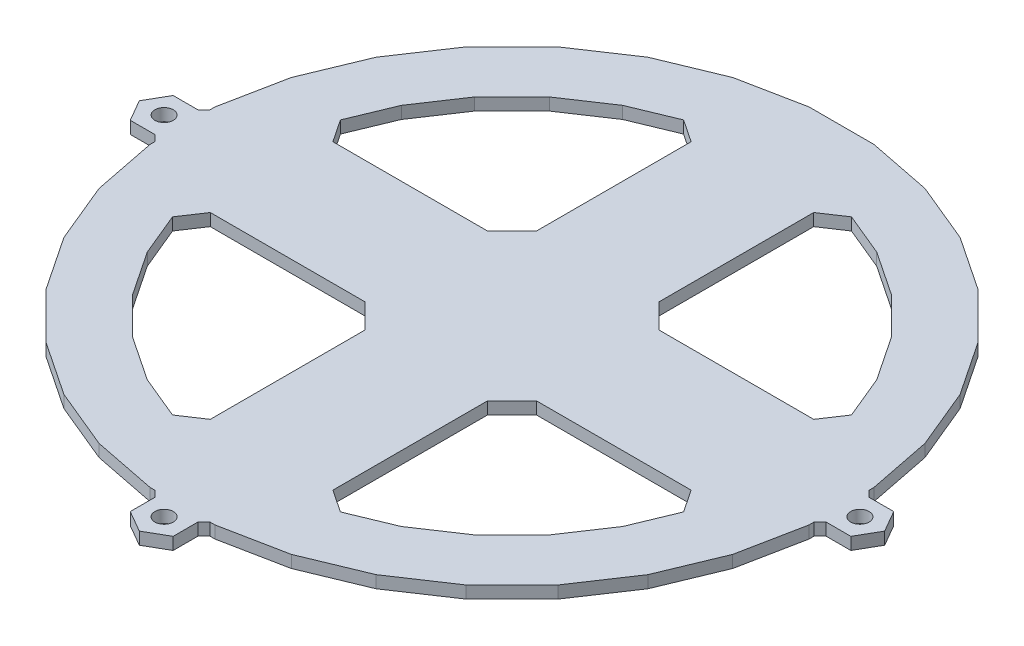
from build123d import *

# Parameters (mm, degrees)
BOSS_EXTRUDE1_DEPTH = 2
SKETCH3_W           = 20
SKETCH3_H           = 87.5
BOSS_EXTRUDE4_DEPTH = 2
CIRPATTERN1_COUNT   = 2
CIRPATTERN1_ANGLE   = 90
CHAMFER1_DEPTH      = 2
SKETCH5_R           = 1.5
BOSS_EXTRUDE6_DEPTH = 2
CHAMFER3_SIZE       = 1


with BuildPart() as part:
    # Sketch1 → Boss-Extrude1 (new body)
    with BuildSketch(Plane(origin=(0, 0, 0), x_dir=(1, 0, 0), z_dir=(0, 1, 0))):
        Polygon((53.75, 5.29391293), (51.684417643, 15.678296686), (47.632632102, 25.460172293), (41.750351221, 34.263627757), (34.263627757, 41.750351221), (25.460172293, 47.632632102), (15.678296686, 51.684417643), (5.29391293, 53.75), (-5.29391293, 53.75), (-15.678296686, 51.684417643), (-25.460172293, 47.632632102), (-34.263627757, 41.750351221), (-41.750351221, 34.263627757), (-47.632632102, 25.460172293), (-51.684417643, 15.678296686), (-53.75, 5.29391293), (-53.75, -5.29391293), (-51.684417643, -15.678296686), (-47.632632102, -25.460172293), (-41.750351221, -34.263627757), (-34.263627757, -41.750351221), (-25.460172293, -47.632632102), (-15.678296686, -51.684417643), (-5.29391293, -53.75), (5.29391293, -53.75), (15.678296686, -51.684417643), (25.460172293, -47.632632102), (34.263627757, -41.750351221), (41.750351221, -34.263627757), (47.632632102, -25.460172293), (51.684417643, -15.678296686), (53.75, -5.29391293), align=None)
        Polygon((43.75, 4.308998897), (42.068712035, 12.76140428), (38.770747059, 20.723396052), (33.982844017, 27.888999337), (27.888999337, 33.982844017), (20.723396052, 38.770747059), (12.76140428, 42.068712035), (4.308998897, 43.75), (-4.308998897, 43.75), (-12.76140428, 42.068712035), (-20.723396052, 38.770747059), (-27.888999337, 33.982844017), (-33.982844017, 27.888999337), (-38.770747059, 20.723396052), (-42.068712035, 12.76140428), (-43.75, 4.308998897), (-43.75, -4.308998897), (-42.068712035, -12.76140428), (-38.770747059, -20.723396052), (-33.982844017, -27.888999337), (-27.888999337, -33.982844017), (-20.723396052, -38.770747059), (-12.76140428, -42.068712035), (-4.308998897, -43.75), (4.308998897, -43.75), (12.76140428, -42.068712035), (20.723396052, -38.770747059), (27.888999337, -33.982844017), (33.982844017, -27.888999337), (38.770747059, -20.723396052), (42.068712035, -12.76140428), (43.75, -4.308998897), align=None, mode=Mode.SUBTRACT)
    extrude(amount=BOSS_EXTRUDE1_DEPTH)

    # Sketch3 → Boss-Extrude4 (add)
    with BuildSketch(Plane(origin=(0, 2, 0), x_dir=(1, 0, 0), z_dir=(0, 1, 0))):
        Rectangle(SKETCH3_W, SKETCH3_H)
    boss_extrude4 = extrude(amount=-BOSS_EXTRUDE4_DEPTH)

    # CirPattern1: Boss-Extrude4 ×2 about axis
    cirpattern1_axis = Axis((0, 2, 0), (0, 1, 0))
    for i in range(1, CIRPATTERN1_COUNT):
        add(boss_extrude4.rotate(cirpattern1_axis, i * CIRPATTERN1_ANGLE / (CIRPATTERN1_COUNT - 1)))

    # Chamfer1: read off the stored shape, not the designer's step
    # Chamfer1 outline → Chamfer1 (add)
    with BuildSketch(Plane(origin=(0, 0, 0), x_dir=(1, 0, 0), z_dir=(0, 1, 0))):
        Polygon((10, -10), (10, -14), (14, -10), align=None)
        Polygon((13.692057296, -41.683222934), (10, -39.216269119), (10, -42.617989498), (12.76140428, -42.068712035), align=None)
        Polygon((42.617989498, -10), (39.216269119, -10), (41.683222934, -13.692057296), (42.068712035, -12.76140428), align=None)
        Polygon((-10, 10), (-10, 14), (-14, 10), align=None)
        Polygon((-13.692057296, 41.683222934), (-10, 39.216269119), (-10, 42.617989498), (-12.76140428, 42.068712035), align=None)
        Polygon((-42.617989498, 10), (-39.216269119, 10), (-41.683222934, 13.692057296), (-42.068712035, 12.76140428), align=None)
        Polygon((10, 10), (14, 10), (10, 14), align=None)
        Polygon((41.683222934, 13.692057296), (39.216269119, 10), (42.617989498, 10), (42.068712035, 12.76140428), align=None)
        Polygon((10, 42.617989498), (10, 39.216269119), (13.692057296, 41.683222934), (12.76140428, 42.068712035), align=None)
        Polygon((-10, -10), (-14, -10), (-10, -14), align=None)
        Polygon((-41.683222934, -13.692057296), (-39.216269119, -10), (-42.617989498, -10), (-42.068712035, -12.76140428), align=None)
        Polygon((-10, -42.617989498), (-10, -39.216269119), (-13.692057296, -41.683222934), (-12.76140428, -42.068712035), align=None)
    extrude(amount=CHAMFER1_DEPTH)

    # Sketch5 → Boss-Extrude6 (add)
    # profile 1 of 3: a face of its own
    with BuildSketch(Plane(origin=(0, 2, 0), x_dir=(1, 0, 0), z_dir=(0, 1, 0))):
        Polygon((-54.729274058, 3.5), (-58.770725942, 3.5), (-60.791451884, 0), (-58.770725942, -3.5), (-54.729274058, -3.5), (-53.75, -3.5), (-53.75, 3.5), align=None)
        with Locations(Location((-56.75, 0, 0), (0, 0, 270))):
            Circle(SKETCH5_R, mode=Mode.SUBTRACT)
    # profile 2 of 3: a face of its own
    with BuildSketch(Plane(origin=(0, 2, 0), x_dir=(1, 0, 0), z_dir=(0, 1, 0))):
        Polygon((54.729274058, 3.5), (53.75, 3.5), (53.75, -3.5), (54.729274058, -3.5), (58.770725942, -3.5), (60.791451884, 0), (58.770725942, 3.5), align=None)
        with Locations(Location((56.75, 0, 0), (0, 0, 270))):
            Circle(SKETCH5_R, mode=Mode.SUBTRACT)
    # profile 3 of 3: a face of its own
    with BuildSketch(Plane(origin=(0, 2, 0), x_dir=(1, 0, 0), z_dir=(0, 1, 0))):
        Polygon((3.5, -54.729274058), (3.5, -53.75), (-3.5, -53.75), (-3.5, -54.729274058), (-3.5, -58.770725942), (0, -60.791451884), (3.5, -58.770725942), align=None)
        with Locations(Location((0, -56.75, 0), (0, 0, 270))):
            Circle(SKETCH5_R, mode=Mode.SUBTRACT)
    extrude(amount=-BOSS_EXTRUDE6_DEPTH)

    # Chamfer3
    chamfer3_edges = [part.edges().sort_by_distance(p)[0] for p in [
        (-53.75, 1, 3.5),
        (-53.75, 1, -3.5),
        (53.75, 1, -3.5),
        (53.75, 1, 3.5),
        (3.5, 1, 53.75),
        (-3.5, 1, 53.75),
    ]]
    chamfer(chamfer3_edges, length=CHAMFER3_SIZE)


solid = part.part
